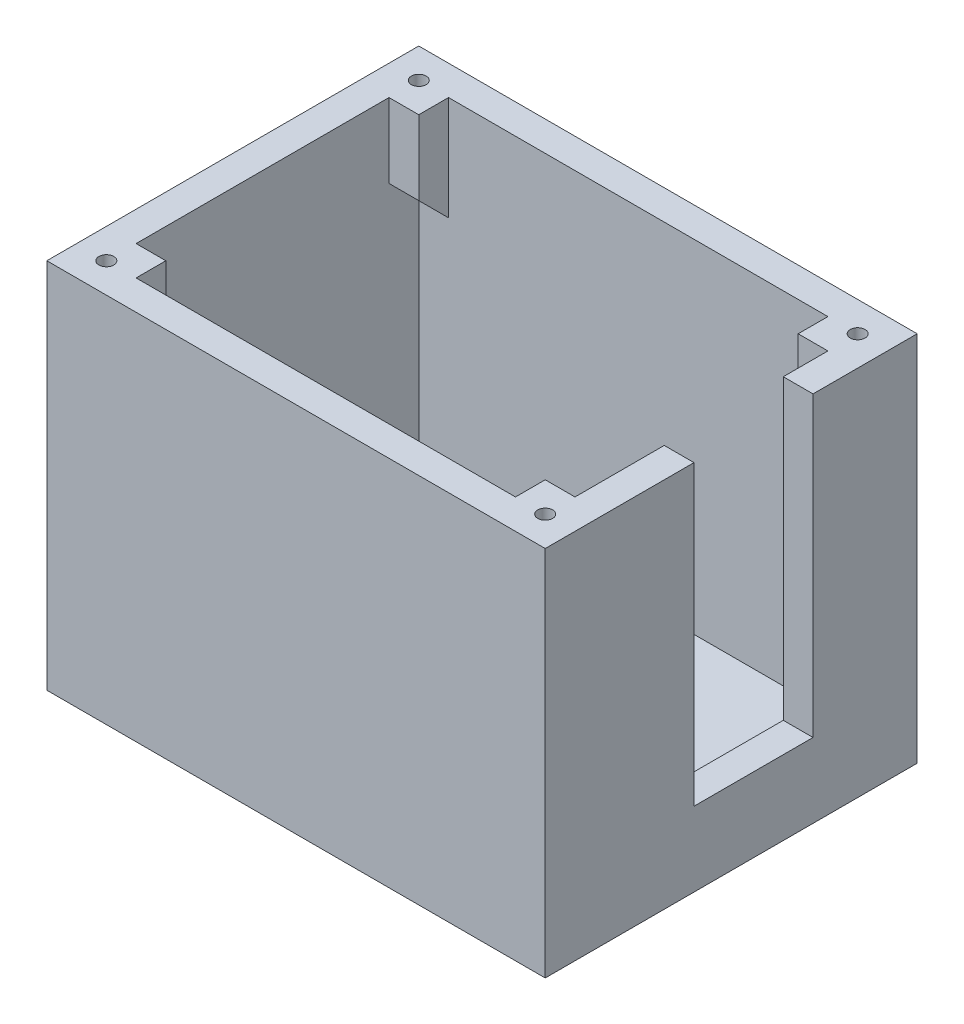
from build123d import *

# Parameters (mm, degrees)
SKETCH1_W           = 33.5
SKETCH1_H           = 25
SKETCH1_W_2         = 29.5
SKETCH1_H_2         = 21
BOSS_EXTRUDE1_DEPTH = 2
SKETCH1_3_W         = 33.5
SKETCH1_3_H         = 25
SKETCH1_3_W_2       = 29.5
SKETCH1_3_H_2       = 21
BOSS_EXTRUDE2_DEPTH = 25
SKETCH2_W           = 2
SKETCH2_H           = 8
CUT_EXTRUDE1_DEPTH  = 20
SKETCH3_W           = 2
SKETCH3_H           = 2
BOSS_EXTRUDE3_DEPTH = 5
CHAMFER1_SIZE       = 2
CUT_EXTRUDE2_DEPTH  = 5


with BuildPart() as part:
    # Sketch1 → Boss-Extrude1 (new body)
    # profile 1 of 2: a face of its own
    with BuildSketch(Plane(origin=(0, 0, 0), x_dir=(1, 0, 0), z_dir=(0, 1, 0))):
        with Locations((5.204545455, 5.939393939)):
            Rectangle(SKETCH1_W, SKETCH1_H)
        with Locations((5.204545455, 5.939393939)):
            Rectangle(SKETCH1_W_2, SKETCH1_H_2, mode=Mode.SUBTRACT)
    # profile 2 of 2: a face of its own
    with BuildSketch(Plane(origin=(0, 0, 0), x_dir=(1, 0, 0), z_dir=(0, 1, 0))):
        with Locations((5.204545455, 5.939393939)):
            Rectangle(SKETCH1_W_2, SKETCH1_H_2)
    extrude(amount=BOSS_EXTRUDE1_DEPTH)

    # Sketch1<3> → Boss-Extrude2 (add)
    with BuildSketch(Plane(origin=(0, 0, 0), x_dir=(1, 0, 0), z_dir=(0, 1, 0))):
        with Locations((5.204545455, 5.939393939)):
            Rectangle(SKETCH1_3_W, SKETCH1_3_H)
        with Locations((5.204545455, 5.939393939)):
            Rectangle(SKETCH1_3_W_2, SKETCH1_3_H_2, mode=Mode.SUBTRACT)
    extrude(amount=BOSS_EXTRUDE2_DEPTH)

    # Sketch2 → Cut-Extrude1 (cut)
    with BuildSketch(Plane(origin=(0, 25, 0), x_dir=(1, 0, 0), z_dir=(0, 1, 0))):
        with Locations((20.954545455, 7.439393939)):
            Rectangle(SKETCH2_W, SKETCH2_H)
    extrude(amount=-CUT_EXTRUDE1_DEPTH, mode=Mode.SUBTRACT)

    # Sketch3 → Boss-Extrude3 (add)
    with BuildSketch(Plane(origin=(0, 25, 0), x_dir=(1, 0, 0), z_dir=(0, 1, 0))):
        with Locations((-8.545454545, 15.439393939)):
            Rectangle(SKETCH3_W, SKETCH3_H)
        with Locations((-8.545454545, -3.560606061)):
            Rectangle(SKETCH3_W, SKETCH3_H)
        with Locations((18.954545455, -3.560606061)):
            Rectangle(SKETCH3_W, SKETCH3_H)
        with Locations((18.954545455, 15.439393939)):
            Rectangle(SKETCH3_W, SKETCH3_H)
    extrude(amount=-BOSS_EXTRUDE3_DEPTH)

    # Chamfer1
    chamfer1_edges = [part.edges().sort_by_distance(p)[0] for p in [
        (18.954545455, 20, 4.560606061),
        (-8.545454545, 20, 4.560606061),
        (18.954545455, 20, -16.439393939),
        (-8.545454545, 20, -16.439393939),
    ]]
    chamfer(chamfer1_edges, length=CHAMFER1_SIZE - 0.0001)  # a hair under: the kernel refuses the full size

    # Sketch4 → Cut-Extrude2 (cut)
    with BuildSketch(Plane(origin=(0, 25, 0), x_dir=(1, 0, 0), z_dir=(0, 1, 0))):
        with BuildLine():
            ThreePointArc((20.454545455, -4.560606061), (20.308098845, -4.20705267), (19.954545455, -4.060606061))
            Line((19.954545455, -4.060606061), (19.954545455, -4.560606061))
            Line((19.954545455, -4.560606061), (19.454545455, -4.560606061))
            ThreePointArc((19.454545455, -4.560606061), (19.954545455, -5.060606061), (20.454545455, -4.560606061))
        make_face()
        with BuildLine():
            Line((19.954545455, -4.560606061), (19.954545455, -4.060606061))
            ThreePointArc((19.954545455, -4.060606061), (19.600992064, -4.20705267), (19.454545455, -4.560606061))
            Line((19.454545455, -4.560606061), (19.954545455, -4.560606061))
        make_face()
        with BuildLine():
            ThreePointArc((20.454545455, -4.560606061), (20.308098845, -4.20705267), (19.954545455, -4.060606061))
            Line((19.954545455, -4.060606061), (19.954545455, -4.560606061))
            Line((19.954545455, -4.560606061), (19.454545455, -4.560606061))
            ThreePointArc((19.454545455, -4.560606061), (19.954545455, -5.060606061), (20.454545455, -4.560606061))
        make_face()
        with BuildLine():
            Line((19.954545455, -4.560606061), (19.954545455, -4.060606061))
            ThreePointArc((19.954545455, -4.060606061), (19.600992064, -4.20705267), (19.454545455, -4.560606061))
            Line((19.454545455, -4.560606061), (19.954545455, -4.560606061))
        make_face()
        with BuildLine():
            ThreePointArc((20.454545455, 16.439393939), (19.954545455, 16.939393939), (19.454545455, 16.439393939))
            Line((19.454545455, 16.439393939), (19.954545455, 16.439393939))
            Line((19.954545455, 16.439393939), (19.954545455, 15.939393939))
            ThreePointArc((19.954545455, 15.939393939), (20.308098845, 16.085840549), (20.454545455, 16.439393939))
        make_face()
        with BuildLine():
            Line((19.954545455, 16.439393939), (19.454545455, 16.439393939))
            ThreePointArc((19.454545455, 16.439393939), (19.600992064, 16.085840549), (19.954545455, 15.939393939))
            Line((19.954545455, 15.939393939), (19.954545455, 16.439393939))
        make_face()
        with BuildLine():
            ThreePointArc((20.454545455, 16.439393939), (19.954545455, 16.939393939), (19.454545455, 16.439393939))
            Line((19.454545455, 16.439393939), (19.954545455, 16.439393939))
            Line((19.954545455, 16.439393939), (19.954545455, 15.939393939))
            ThreePointArc((19.954545455, 15.939393939), (20.308098845, 16.085840549), (20.454545455, 16.439393939))
        make_face()
        with BuildLine():
            Line((19.954545455, 16.439393939), (19.454545455, 16.439393939))
            ThreePointArc((19.454545455, 16.439393939), (19.600992064, 16.085840549), (19.954545455, 15.939393939))
            Line((19.954545455, 15.939393939), (19.954545455, 16.439393939))
        make_face()
        with BuildLine():
            ThreePointArc((-9.545454545, 15.939393939), (-9.191901155, 16.085840549), (-9.045454545, 16.439393939))
            Line((-9.045454545, 16.439393939), (-9.545454545, 16.439393939))
            Line((-9.545454545, 16.439393939), (-9.545454545, 15.939393939))
        make_face()
        with BuildLine():
            Line((-9.545454545, 16.439393939), (-9.045454545, 16.439393939))
            ThreePointArc((-9.045454545, 16.439393939), (-9.899007936, 16.79294733), (-9.545454545, 15.939393939))
            Line((-9.545454545, 15.939393939), (-9.545454545, 16.439393939))
        make_face()
        with BuildLine():
            ThreePointArc((-9.545454545, 15.939393939), (-9.191901155, 16.085840549), (-9.045454545, 16.439393939))
            Line((-9.045454545, 16.439393939), (-9.545454545, 16.439393939))
            Line((-9.545454545, 16.439393939), (-9.545454545, 15.939393939))
        make_face()
        with BuildLine():
            Line((-9.545454545, 16.439393939), (-9.045454545, 16.439393939))
            ThreePointArc((-9.045454545, 16.439393939), (-9.899007936, 16.79294733), (-9.545454545, 15.939393939))
            Line((-9.545454545, 15.939393939), (-9.545454545, 16.439393939))
        make_face()
        with BuildLine():
            ThreePointArc((-9.045454545, -4.560606061), (-9.191901155, -4.20705267), (-9.545454545, -4.060606061))
            Line((-9.545454545, -4.060606061), (-9.545454545, -4.560606061))
            Line((-9.545454545, -4.560606061), (-9.045454545, -4.560606061))
        make_face()
        with BuildLine():
            Line((-9.545454545, -4.560606061), (-9.545454545, -4.060606061))
            ThreePointArc((-9.545454545, -4.060606061), (-9.899007936, -4.914159451), (-9.045454545, -4.560606061))
            Line((-9.045454545, -4.560606061), (-9.545454545, -4.560606061))
        make_face()
        with BuildLine():
            ThreePointArc((-9.045454545, -4.560606061), (-9.191901155, -4.20705267), (-9.545454545, -4.060606061))
            Line((-9.545454545, -4.060606061), (-9.545454545, -4.560606061))
            Line((-9.545454545, -4.560606061), (-9.045454545, -4.560606061))
        make_face()
        with BuildLine():
            Line((-9.545454545, -4.560606061), (-9.545454545, -4.060606061))
            ThreePointArc((-9.545454545, -4.060606061), (-9.899007936, -4.914159451), (-9.045454545, -4.560606061))
            Line((-9.045454545, -4.560606061), (-9.545454545, -4.560606061))
        make_face()
    extrude(amount=-CUT_EXTRUDE2_DEPTH, mode=Mode.SUBTRACT)


solid = part.part
